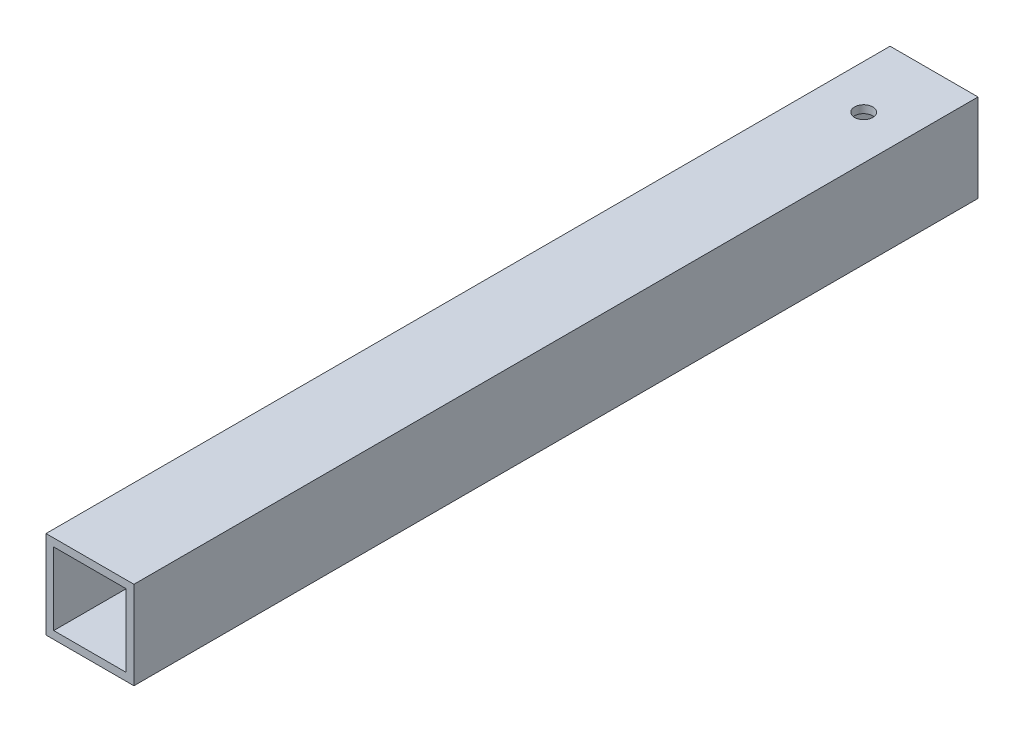
from build123d import *

# Parameters (mm, degrees)
SKETCH1_W           = 31.75
SKETCH1_H           = 31.75
SKETCH1_W_2         = 26.162
SKETCH1_H_2         = 26.162
BOSS_EXTRUDE1_DEPTH = 304.8
SKETCH2_R           = 3.302
CUT_EXTRUDE1_DEPTH  = 307.860095361


with BuildPart() as part:
    # Sketch1 → Boss-Extrude1 (new body)
    with BuildSketch(Plane.XY):
        Rectangle(SKETCH1_W, SKETCH1_H)
        Rectangle(SKETCH1_W_2, SKETCH1_H_2, mode=Mode.SUBTRACT)
    extrude(amount=BOSS_EXTRUDE1_DEPTH)

    # Sketch2 → Cut-Extrude1 (cut, through all)
    with BuildSketch(Plane(origin=(0, 15.875, 0), x_dir=(1, 0, 0), z_dir=(0, 1, 0))):
        with Locations((0, -25.4)):
            Circle(SKETCH2_R)
    extrude(amount=-CUT_EXTRUDE1_DEPTH, mode=Mode.SUBTRACT)


solid = part.part
